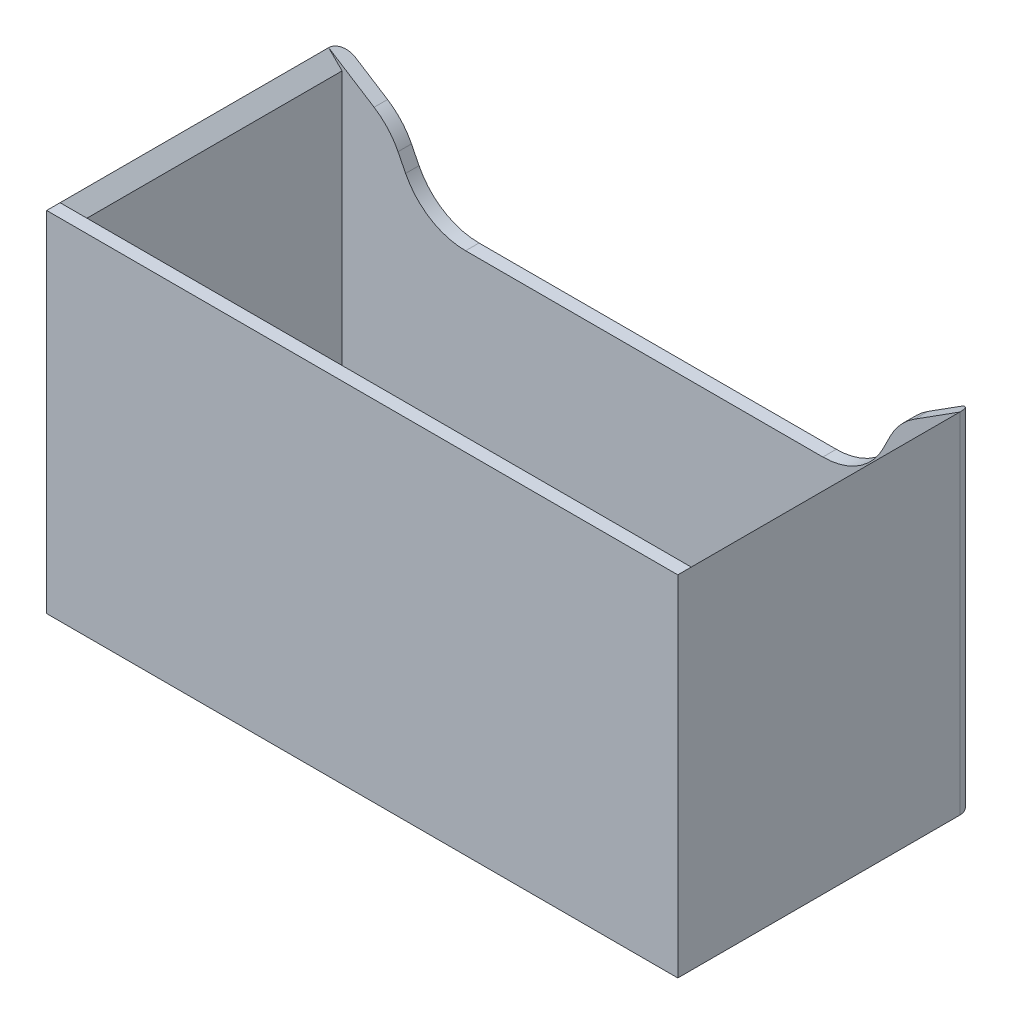
from build123d import *

# Parameters (mm, degrees)
CROQUIS1_W              = 45
CROQUIS1_H              = 20
SALIENTE_EXTRUIR1_DEPTH = 25
VACIADO5_T              = 1
REDONDEO1_R             = 1
CORTAR_EXTRUIR1_START   = -10
CORTAR_EXTRUIR1_DEPTH   = 5
CHAFL_N2_SIZE           = 1


with BuildPart() as part:
    # Croquis1 → Saliente-Extruir1 (new body)
    with BuildSketch(Plane(origin=(0, 0, 0), x_dir=(1, 0, 0), z_dir=(0, 1, 0))):
        Rectangle(CROQUIS1_W, CROQUIS1_H)
    extrude(amount=SALIENTE_EXTRUIR1_DEPTH)

    # Vaciado5
    vaciado5_openings = [part.faces().sort_by_distance(p)[0] for p in [
        (0, 25, 0),
    ]]
    offset(amount=VACIADO5_T, openings=vaciado5_openings, kind=Kind.INTERSECTION)

    # Redondeo1
    # the kernel refuses this fillet: 1 mm, written as the material it takes off along each edge
    with BuildSketch(Plane(origin=(-23.5, -3.5, -11), x_dir=(1, 0, 0), z_dir=(0, 1, 0)), Plane(origin=(23.5, -3.5, -11), x_dir=(0, 0, 1), z_dir=(0, 1, 0))) as redondeo1_piece_1:
        with BuildLine():
            CenterArc((REDONDEO1_R, -REDONDEO1_R), REDONDEO1_R, 90, 90)
            Line((0, -REDONDEO1_R), (0, 0))
            Line((0, 0), (REDONDEO1_R, 0))
        make_face()
    extrude(amount=31, mode=Mode.SUBTRACT)

    # Croquis2 → Cortar-Extruir1 (cut)
    with BuildSketch(Plane.XY.offset(CORTAR_EXTRUIR1_START)):
        with BuildLine():
            ThreePointArc((17.768716436, 19.753391932), (15.925504733, 17.743649431), (13.30186607, 17))
            Line((13.30186607, 17), (-13.30186607, 17))
            ThreePointArc((-13.30186607, 17), (-15.925504733, 17.743649431), (-17.768716436, 19.753391932))
            Line((-17.768716436, 19.753391932), (-18.332567601, 20.87447701))
            ThreePointArc((-18.332567601, 20.87447701), (-19.090471642, 21.981034188), (-20.115254744, 22.846312707))
            Line((-20.115254744, 22.846312707), (-23.5, 25))
            Line((-23.5, 25), (23.5, 25))
            Line((23.5, 25), (20.115254744, 22.846312707))
            ThreePointArc((20.115254744, 22.846312707), (19.090471642, 21.981034188), (18.332567601, 20.87447701))
            Line((18.332567601, 20.87447701), (17.768716436, 19.753391932))
        make_face()
    extrude(amount=-CORTAR_EXTRUIR1_DEPTH, mode=Mode.SUBTRACT)

    # Chaflán1
    # the kernel refuses this chamfer: 1 mm, written as the material it takes off along each edge
    with BuildSketch(Plane(origin=(-22.5, 25, -10), x_dir=(0.027495876610585647, -0.9996219169112968, 0), z_dir=(0, 0, 1))) as chafl_n1_piece_1:
        with BuildLine():
            Line((1.028673195, 0), (-0.056547155, -1.027117794))
            Line((-0.056547155, -1.027117794), (-0.076539593, -1.026567876))
            ThreePointArc((-0.076539593, -1.026567876), (-0.034129227, -0.51339783), (-0.019992438, 0.000549918))
            Line((-0.019992438, 0.000549918), (0.000549918, 0.019992438))
            ThreePointArc((0.000549918, 0.019992438), (0.514497665, 0.00585565), (1.029223113, 0.019992438))
            Line((1.029223113, 0.019992438), (1.028673195, 0))
        make_face()
    extrude(amount=20, mode=Mode.SUBTRACT)

    # Chaflán2
    # the kernel refuses this chamfer: 1 mm, written as the material it takes off along each edge
    with BuildSketch(Plane(origin=(22.5, 25, 10), x_dir=(-0.027495876610585647, -0.9996219169112968, 0), z_dir=(0, 0, -1))) as chafl_n2_piece_1:
        Polygon((CHAFL_N2_SIZE * 0.999621916911, -CHAFL_N2_SIZE * 0.0274958766106), (-CHAFL_N2_SIZE * 0.0274958766106, -CHAFL_N2_SIZE * 0.999621916911), (0, 0), align=None)
    extrude(amount=20, mode=Mode.SUBTRACT)


solid = part.part
